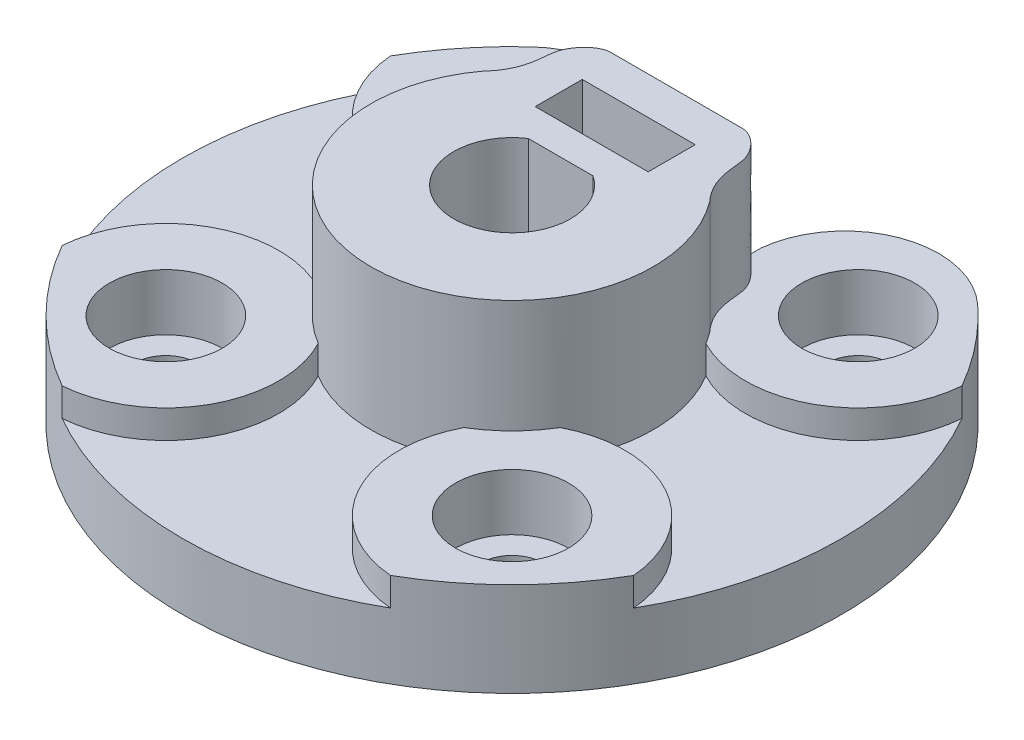
from build123d import *

# Parameters (mm, degrees)
SKETCH_1_R               = 17.5
EXTRUDE_1_DEPTH          = 2
SKETCH_2_R               = 8.75
EXTRUDE_2_DEPTH          = 9
CUT_EXTRUDE_START        = -2
CUT_EXTRUDE_8_DEPTH      = 2
SKETCH_9_R               = 1.65
CUT_EXTRUDE_7_DEPTH      = 27.334388165
PATTERN_CIRCULAR_2_COUNT = 4
SKETCH_10_R              = 17.5
SKETCH_10_R_2            = 8.75
SKETCH_10_R_3            = 3
EXTRUDE_3_DEPTH          = 3
SKETCH_14_W              = 7
SKETCH_14_H              = 5
CUT_EXTRUDE_9_DEPTH      = 34.411263071
SKETCH_3_R               = 1.625
CUT_EXTRUDE_1_DEPTH      = 29.922359862
SKETCH_4_W               = 6
SKETCH_4_H               = 2.5
CUT_EXTRUDE_2_DEPTH      = 28.083205128
SKETCH_11_R              = 1.625
EXTRUDE_4_DEPTH          = 3
FILLET_2_R               = 5
CUT_EXTRUDE_START_2      = -6
CUT_EXTRUDE_11_DEPTH     = 6
CUT_EXTRUDE_START_3      = -1.5
CUT_EXTRUDE_12_DEPTH     = 1.5
EXTRUDE_5_DEPTH          = 11
CUT_EXTRUDE_START_4      = -1
SKETCH_19_R              = 1.625
CUT_EXTRUDE_13_DEPTH     = 1
CUT_EXTRUDE_15_DEPTH     = 6


with BuildPart() as part:
    # Эскиз1 → Бобышка-Вытянуть1 (new body)
    with BuildSketch(Plane(origin=(0, 0, 0), x_dir=(1, 0, 0), z_dir=(0, 1, 0))):
        with Locations(Location((0, 0, 0), (0, 0, 270))):
            Circle(SKETCH_1_R)
    extrude(amount=EXTRUDE_1_DEPTH)

    # Эскиз2 → Бобышка-Вытянуть2 (add)
    with BuildSketch(Plane(origin=(0, 2, 0), x_dir=(1, 0, 0), z_dir=(0, 1, 0))):
        with Locations(Location((0, 0, 0), (0, 0, 270))):
            Circle(SKETCH_2_R)
        with BuildLine():
            Line((-1.763405796, 2.73), (1.763405796, 2.73))
            ThreePointArc((1.763405796, 2.73), (0, -3.25), (-1.763405796, 2.73))
        make_face(mode=Mode.SUBTRACT)
    extrude(amount=EXTRUDE_2_DEPTH)

    # Эскиз12 → Вырез-Вытянуть8 (cut)
    with BuildSketch(Plane(origin=(0, 2, 0), x_dir=(1, 0, 0), z_dir=(0, 1, 0)).offset(CUT_EXTRUDE_START)):
        with BuildLine():
            Line((-1.763405796, 2.73), (1.763405796, 2.73))
            ThreePointArc((1.763405796, 2.73), (0, -3.25), (-1.763405796, 2.73))
        make_face()
    extrude(amount=CUT_EXTRUDE_8_DEPTH, mode=Mode.SUBTRACT)

    # Эскиз9 → Вырез-Вытянуть7 (cut, through all)
    with BuildSketch(Plane(origin=(0, 2, 0), x_dir=(1, 0, 0), z_dir=(0, 1, 0))):
        with Locations(Location((9.192388155, 9.192388155, 0), (0, 0, 270))):
            Circle(SKETCH_9_R)
    cut_extrude_7 = extrude(amount=-CUT_EXTRUDE_7_DEPTH, mode=Mode.SUBTRACT)

    # Круговой массив2: Вырез-Вытянуть7 ×4 about axis
    pattern_circular_2_axis = Axis((0, 0, 0), (0, 1, 0))
    for i in range(1, PATTERN_CIRCULAR_2_COUNT):
        add(cut_extrude_7.rotate(pattern_circular_2_axis, i * 360 / PATTERN_CIRCULAR_2_COUNT), mode=Mode.SUBTRACT)

    # Эскиз10 → Бобышка-Вытянуть3 (add)
    with BuildSketch(Plane(origin=(0, 2, 0), x_dir=(1, 0, 0), z_dir=(0, 1, 0))):
        with Locations(Location((0, 0, 0), (0, 0, 270))):
            Circle(SKETCH_10_R)
        with Locations(Location((0, 0, 0), (0, 0, 270))):
            Circle(SKETCH_10_R_2, mode=Mode.SUBTRACT)
        with Locations(Location((-9.192388155, 9.192388155, 0), (0, 0, 270))):
            Circle(SKETCH_10_R_3, mode=Mode.SUBTRACT)
        with Locations(Location((9.192388155, 9.192388155, 0), (0, 0, 270))):
            Circle(SKETCH_10_R_3, mode=Mode.SUBTRACT)
        with Locations(Location((9.192388155, -9.192388155, 0), (0, 0, 270))):
            Circle(SKETCH_10_R_3, mode=Mode.SUBTRACT)
        with Locations(Location((-9.192388155, -9.192388155, 0), (0, 0, 270))):
            Circle(SKETCH_10_R_3, mode=Mode.SUBTRACT)
    extrude(amount=EXTRUDE_3_DEPTH)

    # Эскиз14 → Вырез-Вытянуть9 (cut, through all)
    with BuildSketch(Plane(origin=(0, 0, -8.75), x_dir=(-1, 0, 0), z_dir=(0, 0, -1))):
        with Locations((0, 2.5)):
            Rectangle(SKETCH_14_W, SKETCH_14_H)
    extrude(amount=CUT_EXTRUDE_9_DEPTH, mode=Mode.SUBTRACT)

    # Эскиз3 → Вырез-Вытянуть1 (cut, through all)
    with BuildSketch(Plane.XY.offset(-2.73)):
        with Locations((0, 6)):
            Circle(SKETCH_3_R)
    extrude(amount=-CUT_EXTRUDE_1_DEPTH, mode=Mode.SUBTRACT)

    # Эскиз4 → Вырез-Вытянуть2 (cut, through all)
    with BuildSketch(Plane(origin=(0, 11, 0), x_dir=(1, 0, 0), z_dir=(0, 1, 0))):
        with Locations((0, 5.48)):
            Rectangle(SKETCH_4_W, SKETCH_4_H)
    extrude(amount=-CUT_EXTRUDE_2_DEPTH, mode=Mode.SUBTRACT)

    # Эскиз11 → Бобышка-Вытянуть4 (add)
    with BuildSketch(Plane.XY.offset(-6.73)):
        Polygon((5, 1), (3.5, 1), (3.5, 0), (-3.5, 0), (-3.5, 1), (-5, 1), (-5, 11), (5, 11), align=None)
        with Locations((0, 6)):
            Circle(SKETCH_11_R, mode=Mode.SUBTRACT)
    extrude(amount=-EXTRUDE_4_DEPTH)

    # Скругление2
    # the kernel refuses this fillet: 5 mm, written as the material it takes off along each edge
    with BuildSketch(Plane(origin=(3.5, 28.475665973, -17.146428199), x_dir=(0.8902152374524571, 0, 0.4555401530133928), z_dir=(0, -1, 0))) as fillet_2_piece_1:
        with BuildLine():
            CenterArc((8.048799762, 4.816686339), FILLET_2_R, 159.077415517, 126.48531946)
            Line((3.378480837, 6.602217391), (3.285074458, 6.637928012))
            ThreePointArc((3.285074458, 6.637928012), (1.600218895, 3.346662711), (-0.089021524, 0.045554015))
            Line((-0.089021524, 0.045554015), (-0.026829333, -0.096333727))
            ThreePointArc((-0.026829333, -0.096333727), (4.695133195, -0.741597813), (9.417095722, -0.096333727))
            Line((9.417095722, -0.096333727), (9.390266389, 0))
        make_face()
    extrude(amount=51.951331945, mode=Mode.SUBTRACT)
    with BuildSketch(Plane(origin=(-3.5, 28.475665973, -17.146428199), x_dir=(-0.8902152374524572, 0, 0.4555401530133924), z_dir=(0, -1, 0))) as fillet_2_piece_2:
        with BuildLine():
            CenterArc((8.048799762, -4.816686339), FILLET_2_R, 74.437265023, 126.48531946)
            Line((3.378480837, -6.602217391), (3.285074458, -6.637928012))
            ThreePointArc((3.285074458, -6.637928012), (1.600218895, -3.346662711), (-0.089021524, -0.045554015))
            Line((-0.089021524, -0.045554015), (-0.026829333, 0.096333727))
            ThreePointArc((-0.026829333, 0.096333727), (4.695133195, 0.741597813), (9.417095722, 0.096333727))
            Line((9.417095722, 0.096333727), (9.390266389, 0))
        make_face()
    extrude(amount=51.951331945, mode=Mode.SUBTRACT)

    # Эскиз16 → Вырез-Вытянуть11 (cut)
    with BuildSketch(Plane(origin=(0, 11, 0), x_dir=(1, 0, 0), z_dir=(0, 1, 0)).offset(CUT_EXTRUDE_START_2)):
        with BuildLine():
            Line((-6, 4.5), (-5, 7.180703308))
            ThreePointArc((-5, 7.180703308), (0, -8.75), (5, 7.180703308))
            Line((5, 7.180703308), (6, 4.5))
            ThreePointArc((6, 4.5), (0, -7.5), (-6, 4.5))
        make_face()
    extrude(amount=CUT_EXTRUDE_11_DEPTH, mode=Mode.SUBTRACT)

    # Эскиз17 → Вырез-Вытянуть12 (cut)
    with BuildSketch(Plane(origin=(0, 5, 0), x_dir=(1, 0, 0), z_dir=(0, 1, 0)).offset(CUT_EXTRUDE_START_3)):
        with BuildLine():
            ThreePointArc((-15.17363778, 8.718412499), (-17.5, 0), (-15.17363778, -8.718412499))
            ThreePointArc((-15.17363778, -8.718412499), (-12.101500502, -3.944811061), (-6.425279536, -3.868563413))
            ThreePointArc((-6.425279536, -3.868563413), (-7.5, 0), (-6.425279536, 3.868563413))
            ThreePointArc((-6.425279536, 3.868563413), (-12.101500502, 3.944811061), (-15.17363778, 8.718412499))
        make_face()
        with BuildLine():
            ThreePointArc((-8.718412499, -15.17363778), (0, -17.5), (8.718412499, -15.17363778))
            ThreePointArc((8.718412499, -15.17363778), (3.944811061, -12.101500502), (3.868563413, -6.425279536))
            ThreePointArc((3.868563413, -6.425279536), (0, -7.5), (-3.868563413, -6.425279536))
            ThreePointArc((-3.868563413, -6.425279536), (-3.944811061, -12.101500502), (-8.718412499, -15.17363778))
        make_face()
        with BuildLine():
            ThreePointArc((15.17363778, -8.718412499), (17.5, 0), (15.17363778, 8.718412499))
            ThreePointArc((15.17363778, 8.718412499), (12.101500502, 3.944811061), (6.425279536, 3.868563413))
            ThreePointArc((6.425279536, 3.868563413), (7.5, 0), (6.425279536, -3.868563413))
            ThreePointArc((6.425279536, -3.868563413), (12.101500502, -3.944811061), (15.17363778, -8.718412499))
        make_face()
    extrude(amount=CUT_EXTRUDE_12_DEPTH, mode=Mode.SUBTRACT)

    # Эскиз18 → Бобышка-Вытянуть5 (add, through all)
    with BuildSketch(Plane(origin=(0, 11, 0), x_dir=(1, 0, 0), z_dir=(0, 1, 0))):
        with BuildLine():
            Line((-1.763405796, 2.73), (1.763405796, 2.73))
            ThreePointArc((1.763405796, 2.73), (0, -3.25), (-1.763405796, 2.73))
        make_face()
        with BuildLine():
            Line((-1.718604085, 2.58), (1.718604085, 2.58))
            ThreePointArc((1.718604085, 2.58), (0, -3.1), (-1.718604085, 2.58))
        make_face(mode=Mode.SUBTRACT)
    extrude(amount=-EXTRUDE_5_DEPTH)

    # Эскиз19 → Вырез-Вытянуть13 (cut)
    with BuildSketch(Plane(origin=(0, 0, -9.73), x_dir=(-1, 0, 0), z_dir=(0, 0, -1)).offset(CUT_EXTRUDE_START_4)):
        Polygon((-5, 11), (5, 11), (5, 5), (3.5, 5), (3.5, 0), (-3.5, 0), (-3.5, 5), (-5, 5), align=None)
        with Locations(Location((0, 6, 0), (0, 0, 180))):
            Circle(SKETCH_19_R, mode=Mode.SUBTRACT)
    extrude(amount=CUT_EXTRUDE_13_DEPTH, mode=Mode.SUBTRACT)

    # Эскиз20 → Вырез-Вытянуть15 (cut)
    with BuildSketch(Plane(origin=(0, 11, 0), x_dir=(1, 0, 0), z_dir=(0, 1, 0))):
        with BuildLine():
            add(Edge.make_bspline(
                [(-3.5, 8.73), (-4.079656123, 8.73), (-4.842651299, 7.966190202), (-4.988696176, 7.252329412), (-5, 7.180703308)],
                knots=[0, 0, 0, 0, 0.430033256, 0.477814729, 0.477814729, 0.477814729, 0.477814729], degree=3))
            Line((-3.5, 8.73), (-5, 8.73))
            Line((-5, 8.73), (-5, 7.180703308))
        make_face()
        with BuildLine():
            add(Edge.make_bspline(
                [(-5, 7.180703308), (-5.012353513, 7.102425904), (-5.096467294, 6.31678513), (-5.16082419, 5.405951438), (-6, 4.5)],
                knots=[0.477814729, 0.477814729, 0.477814729, 0.477814729, 0.530033256, 1, 1, 1, 1], degree=3))
            Line((-5, 7.180703308), (-6, 4.5))
        make_face()
        with BuildLine():
            Line((5, 8.73), (3.5, 8.73))
            add(Edge.make_bspline(
                [(3.5, 8.73), (4.079656123, 8.73), (4.842651299, 7.966190202), (4.988696176, 7.252329412), (5, 7.180703308)],
                knots=[0, 0, 0, 0, 0.430033256, 0.477814729, 0.477814729, 0.477814729, 0.477814729], degree=3))
            Line((5, 7.180703308), (5, 8.73))
        make_face()
        with BuildLine():
            Line((6, 4.5), (5, 7.180703308))
            add(Edge.make_bspline(
                [(5, 7.180703308), (5.012353513, 7.102425904), (5.096467294, 6.31678513), (5.16082419, 5.405951438), (6, 4.5)],
                knots=[0.477814729, 0.477814729, 0.477814729, 0.477814729, 0.530033256, 1, 1, 1, 1], degree=3))
        make_face()
    extrude(amount=-CUT_EXTRUDE_15_DEPTH, mode=Mode.SUBTRACT)


solid = part.part
